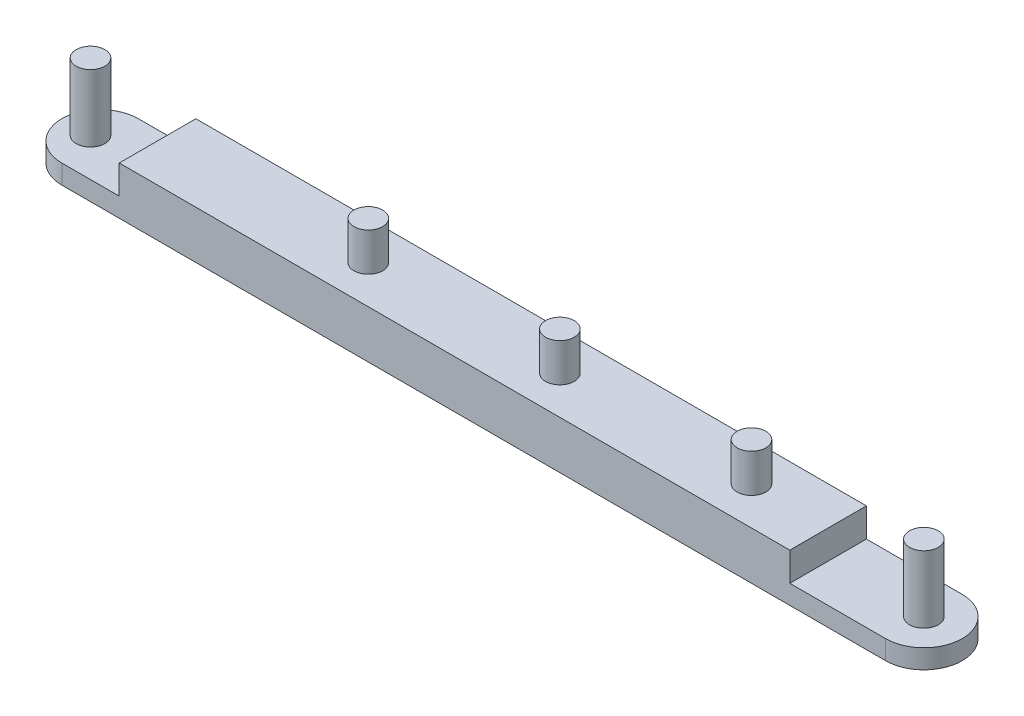
from build123d import *

# Parameters (mm, degrees)
BOSS_EXTRUDE2_DEPTH = 2
SKETCH3_W           = 80
SKETCH3_H           = 8
BOSS_EXTRUDE3_DEPTH = 3
SKETCH4_R           = 1.5
BOSS_EXTRUDE4_DEPTH = 7
SKETCH12_R          = 1.5
BOSS_EXTRUDE6_DEPTH = 4
SKETCH14_W          = 10
SKETCH14_H          = 8
CUT_EXTRUDE1_DEPTH  = 3
SKETCH15_R          = 1.5
BOSS_EXTRUDE7_DEPTH = 7
FILLET1_R           = 4


with BuildPart() as part:
    # Sketch1 → Boss-Extrude2 (new body)
    with BuildSketch(Plane(origin=(0, 0, 0), x_dir=(1, 0, 0), z_dir=(0, 1, 0))):
        with BuildLine():
            Line((-25, -4), (65, -4))
            ThreePointArc((65, -4), (69, 0), (65, 4))
            Line((65, 4), (-25, 4))
            Line((-25, 4), (-25, -4))
        make_face()
    extrude(amount=BOSS_EXTRUDE2_DEPTH)

    # Sketch3 → Boss-Extrude3 (add)
    with BuildSketch(Plane(origin=(0, 2, 0), x_dir=(1, 0, 0), z_dir=(0, 1, 0))):
        with Locations((15, 0)):
            Rectangle(SKETCH3_W, SKETCH3_H)
    extrude(amount=BOSS_EXTRUDE3_DEPTH)

    # Sketch4 → Boss-Extrude4 (add)
    with BuildSketch(Plane(origin=(0, 2, 0), x_dir=(1, 0, 0), z_dir=(0, 1, 0))):
        with Locations(Location((65, 0, 0), (0, 0, 270))):
            Circle(SKETCH4_R)
    extrude(amount=BOSS_EXTRUDE4_DEPTH)

    # Sketch12 → Boss-Extrude6 (add)
    with BuildSketch(Plane(origin=(0, 5, 0), x_dir=(1, 0, 0), z_dir=(0, 1, 0))):
        with Locations(Location((47, 0, 0), (0, 0, 270))):
            Circle(SKETCH12_R)
        with Locations(Location((27, 0, 0), (0, 0, 270))):
            Circle(SKETCH12_R)
        with Locations(Location((7, 0, 0), (0, 0, 270))):
            Circle(SKETCH12_R)
    extrude(amount=BOSS_EXTRUDE6_DEPTH)

    # Sketch14 → Cut-Extrude1 (cut)
    with BuildSketch(Plane(origin=(0, 5, 0), x_dir=(1, 0, 0), z_dir=(0, 1, 0))):
        with Locations((-20, 0)):
            Rectangle(SKETCH14_W, SKETCH14_H)
    extrude(amount=-CUT_EXTRUDE1_DEPTH, mode=Mode.SUBTRACT)

    # Sketch15 → Boss-Extrude7 (add)
    with BuildSketch(Plane(origin=(0, 2, 0), x_dir=(1, 0, 0), z_dir=(0, 1, 0))):
        with Locations(Location((-22, 0, 0), (0, 0, 270))):
            Circle(SKETCH15_R)
    extrude(amount=BOSS_EXTRUDE7_DEPTH)

    # Fillet1
    fillet1_edges = [part.edges().sort_by_distance(p)[0] for p in [
        (-25, 1, -4),
        (-25, 1, 4),
    ]]
    fillet(fillet1_edges, radius=FILLET1_R - 0.0001)  # a hair under: the kernel refuses the full size


solid = part.part
